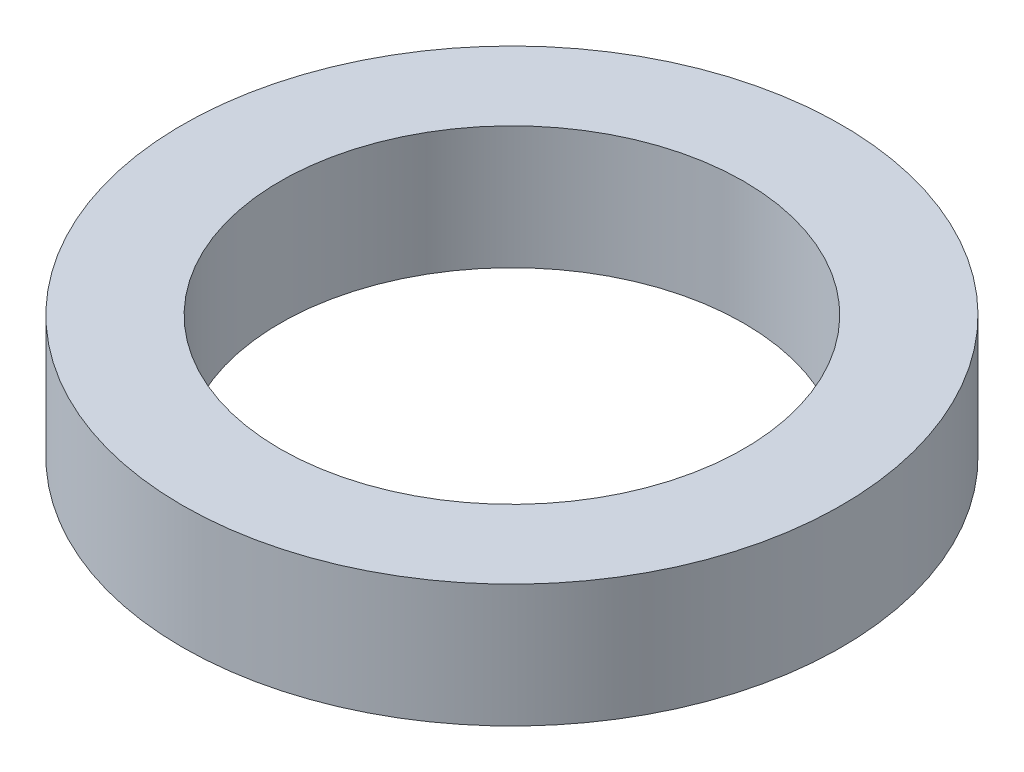
from build123d import *

# Parameters (mm, degrees)
SKETCH1_R           = 7.493
SKETCH1_R_2         = 5.2705
BOSS_EXTRUDE1_DEPTH = 2.794


with BuildPart() as part:
    # Sketch1 → Boss-Extrude1 (new body)
    with BuildSketch(Plane(origin=(0, 0, 0), x_dir=(1, 0, 0), z_dir=(0, 1, 0))):
        Circle(SKETCH1_R)
        Circle(SKETCH1_R_2, mode=Mode.SUBTRACT)
    extrude(amount=BOSS_EXTRUDE1_DEPTH)


solid = part.part
